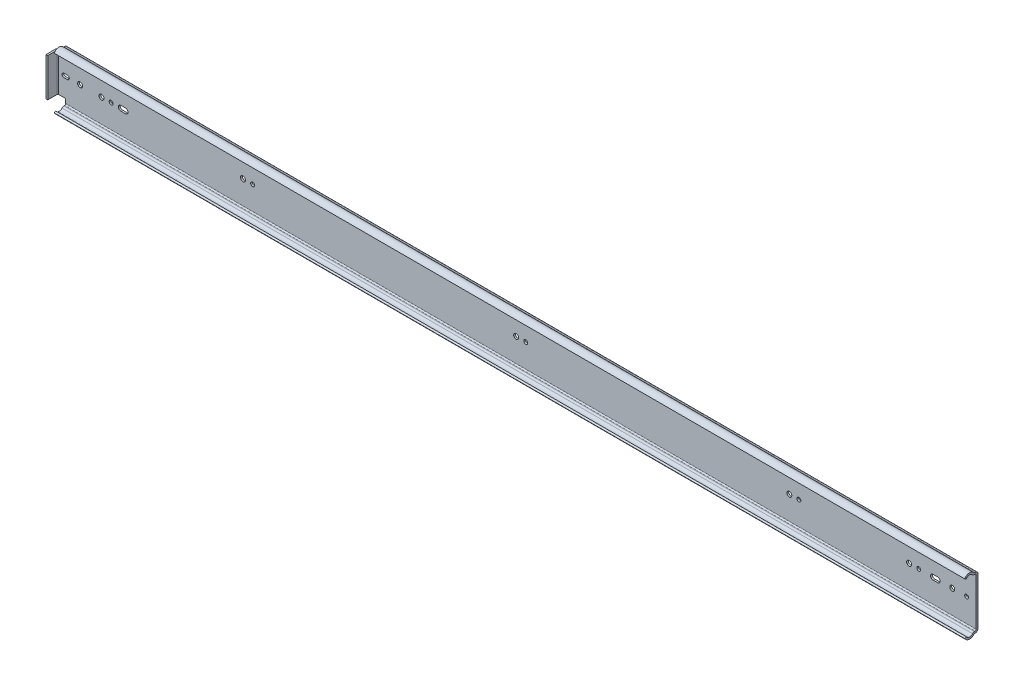
from build123d import *
from build123d.topology import SkipClean

# Parameters (mm, degrees)
EXTRUDE_THIN1_START     = -609.6
EXTRUDE_THIN1_DEPTH     = 1219.2
EXTRUDE_THIN2_DEPTH     = 1212.85
EXTRUDE_THIN5_START     = -1216.66
EXTRUDE_THIN5_DEPTH     = 1216.66
CUT_EXTRUDE1_DEPTH      = 1830.230661576
CUT_EXTRUDE1_DEPTH_BACK = 1830.230661576
SKETCH6_W               = 12.7
SKETCH6_H               = 12.7
SKETCH9_W               = 2.3622
SKETCH9_H               = 13.3858
EXTRUDE1_DEPTH          = 25.4
FILLET1_R               = 1.016
FILLET2_R               = 3.3782
CUT_EXTRUDE2_DEPTH      = 2.3622
SKETCH2_R               = 2.5781
SKETCH2_R_2             = 3.302
CUT_EXTRUDE12_DEPTH     = 2.3622
SKETCH22_R              = 2.5781
SKETCH22_R_2            = 3.302
SKETCH22_R_3            = 3.5687
CUT_EXTRUDE13_DEPTH     = 2.3622
SKETCH23_R              = 2.5781
SKETCH23_R_2            = 3.302
CUT_EXTRUDE14_DEPTH     = 2.3622
SKETCH24_R              = 2.5781
SKETCH24_R_2            = 3.302
CUT_EXTRUDE15_DEPTH     = 2.3622
SKETCH25_R              = 2.5781
SKETCH25_R_2            = 3.302
CUT_EXTRUDE16_DEPTH     = 2.3622
SKETCH27_R              = 3.5687
CUT_E_DEPTH             = 2.3622
SKETCH28_R              = 3.302
CUT_F_DEPTH             = 2.3622
SKETCH29_R              = 2.5781
CUT_EXTRUDE18_DEPTH     = 2.3622
CUT_H_DEPTH             = 2.3622
CUT_J_DEPTH             = 2.3622
SKETCH32_R              = 2.5781
SKETCH32_R_2            = 3.302
CUT_EXTRUDE21_DEPTH     = 2.3622
SKETCH210_R             = 2.5781
SKETCH210_R_2           = 3.302
CUT_EXTRUDE19_DEPTH     = 2.3622
SKETCH211_R             = 2.5781
SKETCH211_R_2           = 3.302
CUT_EXTRUDE110_DEPTH    = 2.3622
SKETCH212_R             = 2.5781
SKETCH212_R_2           = 3.302
CUT_EXTRUDE111_DEPTH    = 2.3622
SKETCH214_R             = 2.5781
SKETCH214_R_2           = 3.302
CUT_EXTRUDE113_DEPTH    = 2.3622
SKETCH215_R             = 3.302
CUT_EXTRUDE114_DEPTH    = 2.3622
CUT_R_DEPTH             = 2.3622
LPATTERN1_COUNT         = 23
LPATTERN1_PITCH         = 25.4
EXTRUDE2_DEPTH          = 12.7
EXTRUDE2_DEPTH_BACK     = 565.15
SKETCH218_W             = 11.43
SKETCH218_H             = 1.27
LPATTERN2_COUNT         = 23
LPATTERN2_PITCH         = 25.4
EXTRUDE3_DEPTH          = 12.7
EXTRUDE3_DEPTH_BACK     = 568.96
SKETCH220_W             = 9.245599771
SKETCH220_H             = 1.27


# Read off the part's stored shape, not the designer's step: Extrude-Thin1, Extrude-Thin5
with BuildPart() as part:
    # Extrude-Thin1 outline → Extrude-Thin1 (new body)
    with BuildSketch(Plane(origin=(0, 0, 0), x_dir=(0, 0, -1), z_dir=(1, 0, 0)).offset(EXTRUDE_THIN1_START)):
        with BuildLine():
            ThreePointArc((5.752462483, 35.334775085), (-0.647910774, 38.071449668), (-6.469678085, 34.255536805))
            Line((-6.469678085, 34.255536805), (-4.394919251, 33.126216382))
            ThreePointArc((-4.394919251, 33.126216382), (-0.440132491, 35.718405464), (3.907707273, 33.85935411))
            ThreePointArc((3.907707273, 33.85935411), (4.993998236, 32.994951487), (6.347544809, 32.686517335))
            Line((6.347544809, 32.686517335), (7.175193262, 32.686517335))
            ThreePointArc((7.175193262, 32.686517335), (8.297725277, 32.22154935), (8.762693262, 31.099017335))
            Line((8.762693262, 31.099017335), (8.762693262, 0))
            Line((8.762693262, 0), (11.124893262, 0))
            Line((11.124893262, 0), (11.124893262, 31.099017335))
            ThreePointArc((11.124893262, 31.099017335), (9.968052916, 33.891876989), (7.175193262, 35.048717335))
            Line((7.175193262, 35.048717335), (6.347544809, 35.048717335))
            ThreePointArc((6.347544809, 35.048717335), (6.017411498, 35.123945177), (5.752462483, 35.334775085))
        make_face()
    extrude(amount=EXTRUDE_THIN1_DEPTH)

    # Sketch6 → Cut-Extrude1 (cut, two sides: drawn at the far end of the back side and taken through both)
    with BuildSketch(Plane.XY.offset(-CUT_EXTRUDE1_DEPTH_BACK)):
        with Locations((-603.25, 31.75)):
            Rectangle(SKETCH6_W, SKETCH6_H)
    extrude(amount=CUT_EXTRUDE1_DEPTH + CUT_EXTRUDE1_DEPTH_BACK, mode=Mode.SUBTRACT)

    # Sketch9 → Extrude1 (add)
    with BuildSketch(Plane(origin=(0, 25.4, 0), x_dir=(-1, 0, 0), z_dir=(0, 1, 0))):
        with Locations((608.4189, -2.069793262)):
            Rectangle(SKETCH9_W, SKETCH9_H)
    extrude(amount=-EXTRUDE1_DEPTH)

    # Fillet1
    fillet1_edges = [part.edges().sort_by_distance(p)[0] for p in [
        (-607.2378, 12.7, -8.762693262),
    ]]
    fillet(fillet1_edges, radius=FILLET1_R)

    # Fillet2
    fillet2_edges = [part.edges().sort_by_distance(p)[0] for p in [
        (-609.6, 12.7, -11.124893262),
    ]]
    fillet(fillet2_edges, radius=FILLET2_R)

    # Sketch32 → Cut-Extrude21 (cut)
    with BuildSketch(Plane.XY.offset(-8.762693262)):
        with Locations((596.9, 0)):
            Circle(SKETCH32_R)
        with Locations((577.85, 0)):
            Circle(SKETCH32_R_2)
        with Locations((520.7, 0)):
            Circle(SKETCH32_R_2)
        with Locations((533.4, 0)):
            Circle(SKETCH32_R)
        with BuildLine():
            Line((549.148, 0), (561.848, 0))
            ThreePointArc((561.848, 0), (560.880866591, 2.334866591), (558.546, 3.302))
            Line((558.546, 3.302), (552.45, 3.302))
            ThreePointArc((552.45, 3.302), (550.115133409, 2.334866591), (549.148, 0))
        make_face()
    extrude(amount=-CUT_EXTRUDE21_DEPTH, mode=Mode.SUBTRACT)

    # Sketch210 → Cut-Extrude19 (cut)
    with BuildSketch(Plane(origin=(-677.249248887, 14.903736783, -8.762693262), x_dir=(1, 0, 0), z_dir=(0, 0, 1))):
        with Locations((1051.899248887, -14.903736783)):
            Circle(SKETCH210_R)
        with Locations((1039.199248887, -14.903736783)):
            Circle(SKETCH210_R_2)
    extrude(amount=-CUT_EXTRUDE19_DEPTH, mode=Mode.SUBTRACT)

    # Sketch211 → Cut-Extrude110 (cut)
    with BuildSketch(Plane(origin=(-447.985498291, 15.81613418, -8.762693262), x_dir=(1, 0, 0), z_dir=(0, 0, 1))):
        with Locations((460.685498291, -15.81613418)):
            Circle(SKETCH211_R)
        with Locations((447.985498291, -15.81613418)):
            Circle(SKETCH211_R_2)
    extrude(amount=-CUT_EXTRUDE110_DEPTH, mode=Mode.SUBTRACT)

    # Sketch212 → Cut-Extrude111 (cut)
    with BuildSketch(Plane(origin=(250.194594693, 14.477181682, -8.762693262), x_dir=(1, 0, 0), z_dir=(0, 0, 1))):
        with Locations((-599.444594693, -14.477181682)):
            Circle(SKETCH212_R)
        with Locations((-612.144594693, -14.477181682)):
            Circle(SKETCH212_R_2)
    extrude(amount=-CUT_EXTRUDE111_DEPTH, mode=Mode.SUBTRACT)

    # Sketch214 → Cut-Extrude113 (cut)
    with BuildSketch(Plane(origin=(529.798432462, 18.139402612, -8.762693262), x_dir=(1, 0, 0), z_dir=(0, 0, 1))):
        with Locations((-1066.500432462, -18.139402612)):
            Circle(SKETCH214_R)
        with Locations((-1079.200432462, -18.139402612)):
            Circle(SKETCH214_R_2)
        with BuildLine():
            Line((-1044.148432462, -18.139402612), (-1056.848432462, -18.139402612))
            ThreePointArc((-1056.848432462, -18.139402612), (-1055.881299054, -15.80453602), (-1053.546432462, -14.837402612))
            Line((-1053.546432462, -14.837402612), (-1047.450432462, -14.837402612))
            ThreePointArc((-1047.450432462, -14.837402612), (-1045.115565871, -15.80453602), (-1044.148432462, -18.139402612))
        make_face()
    extrude(amount=-CUT_EXTRUDE113_DEPTH, mode=Mode.SUBTRACT)

    # Sketch215 → Cut-Extrude114 (cut)
    with BuildSketch(Plane(origin=(674.3557152, 11.320285871, -8.762693262), x_dir=(1, 0, 0), z_dir=(0, 0, 1))):
        with Locations((-1252.2057152, -11.320285871)):
            Circle(SKETCH215_R)
    extrude(amount=-CUT_EXTRUDE114_DEPTH, mode=Mode.SUBTRACT)

    # Sketch216 → Cut R (cut)
    with BuildSketch(Plane.XY.offset(-8.762693262)):
        with BuildLine():
            Line((-601.6625, 0), (-592.1375, 0))
            ThreePointArc((-592.1375, 0), (-592.892608007, 1.822991993), (-594.7156, 2.5781))
            Line((-594.7156, 2.5781), (-599.0844, 2.5781))
            ThreePointArc((-599.0844, 2.5781), (-600.907391993, 1.822991993), (-601.6625, 0))
        make_face()
    extrude(amount=-CUT_R_DEPTH, mode=Mode.SUBTRACT)

    # Mirror1 3: part across plane


with BuildPart() as body_2:
    # Sketch4 → Extrude-Thin2 (new body)
    with BuildSketch(Plane(origin=(1219.2, 0, 0), x_dir=(0, 0, -1), z_dir=(1, 0, 0))):
        with BuildLine():
            ThreePointArc((3.54024831, 19.789205828), (0.77024158, 21.457292879), (-2.36668079, 20.672965307))
            ThreePointArc((-2.36668079, 20.672965307), (-3.091811244, 20.294053258), (-3.898522237, 20.157649845))
            ThreePointArc((-3.898522237, 20.157649845), (-5.766174756, 20.914093138), (-6.542172842, 22.773705828))
            Line((-6.542172842, 22.773705828), (-6.542172842, 25.161305828))
            ThreePointArc((-6.542172842, 25.161305828), (-5.766174756, 27.020918518), (-3.898522237, 27.77736181))
            ThreePointArc((-3.898522237, 27.77736181), (-3.659975019, 27.729624759), (-3.455361804, 27.598030559))
            ThreePointArc((-3.455361804, 27.598030559), (-0.023095262, 26.226172038), (3.414460302, 27.584723163))
            ThreePointArc((3.414460302, 27.584723163), (6.244879756, 28.080225918), (7.822893148, 25.678836527))
            Line((7.822893148, 25.678836527), (7.822893148, 11.408756936))
            ThreePointArc((7.822893148, 11.408756936), (7.431553352, 9.948256936), (6.362393148, 8.879096732))
            Line((6.362393148, 8.879096732), (3.123893148, 7.009347885))
            ThreePointArc((3.123893148, 7.009347885), (2.84498179, 6.730436527), (2.742893148, 6.349436527))
            Line((2.742893148, 6.349436527), (2.742893148, 0))
            Line((2.742893148, 0), (0.583893148, 0))
            Line((0.583893148, 0), (0.583893148, 6.349436527))
            ThreePointArc((0.583893148, 6.349436527), (0.975232943, 7.809936527), (2.044393148, 8.879096732))
            Line((2.044393148, 8.879096732), (5.282893148, 10.748845578))
            ThreePointArc((5.282893148, 10.748845578), (5.561804505, 11.027756936), (5.663893148, 11.408756936))
            Line((5.663893148, 11.408756936), (5.663893148, 25.678836527))
            ThreePointArc((5.663893148, 25.678836527), (5.388123817, 26.098496809), (4.893487408, 26.011904095))
            ThreePointArc((4.893487408, 26.011904095), (0.412345154, 24.079826794), (-4.266408016, 25.466487303))
            ThreePointArc((-4.266408016, 25.466487303), (-4.352985021, 25.324684037), (-4.383172842, 25.161305828))
            Line((-4.383172842, 25.161305828), (-4.383172842, 22.773705828))
            ThreePointArc((-4.383172842, 22.773705828), (-4.247561526, 22.448724969), (-3.921175649, 22.316530996))
            ThreePointArc((-3.921175649, 22.316530996), (-3.780197029, 22.340368486), (-3.653475202, 22.406586125))
            ThreePointArc((-3.653475202, 22.406586125), (1.089702598, 23.592527212), (5.278086268, 21.070299201))
            Line((5.278086268, 21.070299201), (3.54024831, 19.789205828))
        make_face()
    extrude(amount=-EXTRUDE_THIN2_DEPTH)

    # Mirror1: body 2 across plane


with BuildPart() as body_3:
    # Extrude-Thin5 outline → Extrude-Thin5 (new body)
    with BuildSketch(Plane(origin=(1828.8, 0, 0), x_dir=(0, 0, -1), z_dir=(1, 0, 0)).offset(EXTRUDE_THIN5_START)):
        with BuildLine():
            Line((-7.925106738, 0), (-5.562906738, 0))
            Line((-5.562906738, 0), (-5.562906738, 13.036209579))
            ThreePointArc((-5.562906738, 13.036209579), (-5.437890097, 13.255022954), (-5.185904431, 13.258440163))
            Line((-5.185904431, 13.258440163), (-2.932066495, 12.010964405))
            ThreePointArc((-2.932066495, 12.010964405), (1.369676528, 11.28348431), (5.180595526, 13.407423274))
            Line((5.180595526, 13.407423274), (3.41147618, 14.972736527))
            ThreePointArc((3.41147618, 14.972736527), (0.968956668, 13.611447462), (-1.788145038, 14.077708835))
            Line((-1.788145038, 14.077708835), (-4.041982973, 15.325184593))
            ThreePointArc((-4.041982973, 15.325184593), (-6.637435339, 15.28998734), (-7.925106738, 13.036209579))
            Line((-7.925106738, 13.036209579), (-7.925106738, 0))
        make_face()
    extrude(amount=EXTRUDE_THIN5_DEPTH)

    # Sketch10 → Cut-Extrude2 (cut)
    with BuildSketch(Plane.XY.offset(7.925106738)):
        with BuildLine():
            Line((1805.07005, 0), (1823.35805, 0))
            ThreePointArc((1823.35805, 0), (1814.21405, 9.144), (1805.07005, 0))
        make_face()
        with BuildLine():
            Line((1799.6281, 0), (1794.4719, 0))
            ThreePointArc((1794.4719, 0), (1797.05, 2.5781), (1799.6281, 0))
        make_face()
        with BuildLine():
            Line((1781.302, 0), (1774.698, 0))
            ThreePointArc((1774.698, 0), (1778, 3.302), (1781.302, 0))
        make_face()
        with BuildLine():
            Line((1762.252, 3.048), (1762.252, 0))
            Line((1762.252, 0), (1755.648, 0))
            Line((1755.648, 0), (1755.648, 3.048))
            ThreePointArc((1755.648, 3.048), (1758.95, 6.35), (1762.252, 3.048))
        make_face()
        with BuildLine():
            Line((1748.8281, 0), (1743.6719, 0))
            ThreePointArc((1743.6719, 0), (1746.25, 2.5781), (1748.8281, 0))
        make_face()
        with BuildLine():
            Line((1736.852, 0), (1730.248, 0))
            ThreePointArc((1730.248, 0), (1733.55, 3.302), (1736.852, 0))
        make_face()
    extrude(amount=-CUT_EXTRUDE2_DEPTH, mode=Mode.SUBTRACT)

    # Sketch2 → Cut-Extrude12 (cut)
    with BuildSketch(Plane(origin=(-2141.845428582, 6.157941778, 7.925106738), x_dir=(1, 0, 0), z_dir=(0, 0, 1))):
        with Locations((3824.595428582, -6.157941778)):
            Circle(SKETCH2_R)
        with Locations((3811.895428582, -6.157941778)):
            Circle(SKETCH2_R_2)
    extrude(amount=-CUT_EXTRUDE12_DEPTH, mode=Mode.SUBTRACT)

    # Sketch22 → Cut-Extrude13 (cut)
    with BuildSketch(Plane(origin=(-2143.135428603, 5.657950018, 7.925106738), x_dir=(1, 0, 0), z_dir=(0, 0, 1))):
        with Locations((3762.385428603, -5.657950018)):
            Circle(SKETCH22_R)
        with Locations((3730.635428603, -5.657950018)):
            Circle(SKETCH22_R_2)
        with Locations((3749.685428603, -5.657950018)):
            Circle(SKETCH22_R_3)
    extrude(amount=-CUT_EXTRUDE13_DEPTH, mode=Mode.SUBTRACT)

    # Sketch23 → Cut-Extrude14 (cut)
    with BuildSketch(Plane(origin=(-2022.429166167, 5.760053708, 7.925106738), x_dir=(1, 0, 0), z_dir=(0, 0, 1))):
        with Locations((3463.879166167, -5.760053708)):
            Circle(SKETCH23_R)
        with Locations((3451.179166167, -5.760053708)):
            Circle(SKETCH23_R_2)
    extrude(amount=-CUT_EXTRUDE14_DEPTH, mode=Mode.SUBTRACT)

    # Sketch24 → Cut-Extrude15 (cut)
    with BuildSketch(Plane(origin=(-1862.330020924, 7.905664942, 7.925106738), x_dir=(1, 0, 0), z_dir=(0, 0, 1))):
        with Locations((3151.380020924, -7.905664942)):
            Circle(SKETCH24_R)
        with Locations((3138.680020924, -7.905664942)):
            Circle(SKETCH24_R_2)
    extrude(amount=-CUT_EXTRUDE15_DEPTH, mode=Mode.SUBTRACT)

    # Sketch25 → Cut-Extrude16 (cut)
    with BuildSketch(Plane(origin=(-1718.369763818, 7.737387679, 7.925106738), x_dir=(1, 0, 0), z_dir=(0, 0, 1))):
        with Locations((2702.619763818, -7.737387679)):
            Circle(SKETCH25_R)
        with Locations((2689.919763818, -7.737387679)):
            Circle(SKETCH25_R_2)
    extrude(amount=-CUT_EXTRUDE16_DEPTH, mode=Mode.SUBTRACT)

    # Sketch27 → Cut E (cut)
    with BuildSketch(Plane.XY.offset(7.925106738)):
        with Locations((806.45, 0)):
            Circle(SKETCH27_R)
        with BuildLine():
            Line((796.8615, 0), (780.9865, 0))
            ThreePointArc((780.9865, 0), (781.953633409, 2.334866591), (784.2885, 3.302))
            Line((784.2885, 3.302), (793.5595, 3.302))
            ThreePointArc((793.5595, 3.302), (795.894366591, 2.334866591), (796.8615, 0))
        make_face()
    extrude(amount=-CUT_E_DEPTH, mode=Mode.SUBTRACT)

    # Sketch28 → Cut F (cut)
    with BuildSketch(Plane.XY.offset(7.925106738)):
        with Locations((728.726, 0)):
            Circle(SKETCH28_R)
    extrude(amount=-CUT_F_DEPTH, mode=Mode.SUBTRACT)

    # Sketch29 → Cut-Extrude18 (cut)
    with BuildSketch(Plane(origin=(-866.129297637, 5.417355799, 7.925106738), x_dir=(1, 0, 0), z_dir=(0, 0, 1))):
        with Locations((1582.155297637, -5.417355799)):
            Circle(SKETCH29_R)
        with BuildLine():
            Line((1574.217797637, -5.417355799), (1564.692797637, -5.417355799))
            ThreePointArc((1564.692797637, -5.417355799), (1565.659931046, -3.082489207), (1567.994797637, -2.115355799))
            Line((1567.994797637, -2.115355799), (1570.915797637, -2.115355799))
            ThreePointArc((1570.915797637, -2.115355799), (1573.250664228, -3.082489207), (1574.217797637, -5.417355799))
        make_face()
    extrude(amount=-CUT_EXTRUDE18_DEPTH, mode=Mode.SUBTRACT)

    # Sketch30 → Cut H (cut)
    with BuildSketch(Plane.XY.offset(7.925106738)):
        with BuildLine():
            Line((680.974, 0), (680.974, 3.048))
            ThreePointArc((680.974, 3.048), (684.276, 6.35), (687.578, 3.048))
            Line((687.578, 3.048), (687.578, 0))
            Line((687.578, 0), (680.974, 0))
        make_face()
    extrude(amount=-CUT_H_DEPTH, mode=Mode.SUBTRACT)

    # Sketch31 → Cut J (cut)
    with BuildSketch(Plane.XY.offset(7.925106738)):
        with BuildLine():
            Line((669.9885, 0), (660.4635, 0))
            ThreePointArc((660.4635, 0), (661.218608007, 1.822991993), (663.0416, 2.5781))
            Line((663.0416, 2.5781), (667.4104, 2.5781))
            ThreePointArc((667.4104, 2.5781), (669.233391993, 1.822991993), (669.9885, 0))
        make_face()
    extrude(amount=-CUT_J_DEPTH, mode=Mode.SUBTRACT)

    # Mirror1 2: body 3 across plane


with BuildPart() as body_2_1:
    add(body_2.part)
    add(body_2.part.mirror(Plane.ZX))


with BuildPart() as body_3_1:
    with SkipClean():  # the faces are left unmerged after this step: merging them gives an invalid solid
        add(body_3.part)
        add(body_3.part.mirror(Plane.ZX))


with BuildPart() as part_1:
    with SkipClean():  # the faces are left unmerged after this step: merging them gives an invalid solid
        add(part.part)
        add(part.part.mirror(Plane.ZX))


with BuildPart() as body_4:
    # Sketch217 → Revolve1 (revolve)
    with BuildSketch(Plane(origin=(584.2, 0, 0), x_dir=(0, 0, -1), z_dir=(1, 0, 0))):
        with BuildLine():
            Line((0, 35.7378), (0, 26.22652483))
            ThreePointArc((0, 26.22652483), (4.755637585, 30.982162415), (0, 35.7378))
        make_face()
    revolve(axis=Axis((584.2, 36.603094088, 0), (0, -1, 0)))


with BuildPart() as lpattern1_1:
    # LPattern1: pattern copy
    add(body_4.part.moved(Location(Vector(-1, 0, 0) * (1 * LPATTERN1_PITCH))))


with BuildPart() as lpattern1_2:
    # LPattern1: pattern copy
    add(body_4.part.moved(Location(Vector(-1, 0, 0) * (2 * LPATTERN1_PITCH))))


with BuildPart() as lpattern1_3:
    # LPattern1: pattern copy
    add(body_4.part.moved(Location(Vector(-1, 0, 0) * (3 * LPATTERN1_PITCH))))


with BuildPart() as lpattern1_4:
    # LPattern1: pattern copy
    add(body_4.part.moved(Location(Vector(-1, 0, 0) * (4 * LPATTERN1_PITCH))))


with BuildPart() as lpattern1_5:
    # LPattern1: pattern copy
    add(body_4.part.moved(Location(Vector(-1, 0, 0) * (5 * LPATTERN1_PITCH))))


with BuildPart() as lpattern1_6:
    # LPattern1: pattern copy
    add(body_4.part.moved(Location(Vector(-1, 0, 0) * (6 * LPATTERN1_PITCH))))


with BuildPart() as lpattern1_7:
    # LPattern1: pattern copy
    add(body_4.part.moved(Location(Vector(-1, 0, 0) * (7 * LPATTERN1_PITCH))))


with BuildPart() as lpattern1_8:
    # LPattern1: pattern copy
    add(body_4.part.moved(Location(Vector(-1, 0, 0) * (8 * LPATTERN1_PITCH))))


with BuildPart() as lpattern1_9:
    # LPattern1: pattern copy
    add(body_4.part.moved(Location(Vector(-1, 0, 0) * (9 * LPATTERN1_PITCH))))


with BuildPart() as lpattern1_10:
    # LPattern1: pattern copy
    add(body_4.part.moved(Location(Vector(-1, 0, 0) * (10 * LPATTERN1_PITCH))))


with BuildPart() as lpattern1_11:
    # LPattern1: pattern copy
    add(body_4.part.moved(Location(Vector(-1, 0, 0) * (11 * LPATTERN1_PITCH))))


with BuildPart() as lpattern1_12:
    # LPattern1: pattern copy
    add(body_4.part.moved(Location(Vector(-1, 0, 0) * (12 * LPATTERN1_PITCH))))


with BuildPart() as lpattern1_13:
    # LPattern1: pattern copy
    add(body_4.part.moved(Location(Vector(-1, 0, 0) * (13 * LPATTERN1_PITCH))))


with BuildPart() as lpattern1_14:
    # LPattern1: pattern copy
    add(body_4.part.moved(Location(Vector(-1, 0, 0) * (14 * LPATTERN1_PITCH))))


with BuildPart() as lpattern1_15:
    # LPattern1: pattern copy
    add(body_4.part.moved(Location(Vector(-1, 0, 0) * (15 * LPATTERN1_PITCH))))


with BuildPart() as lpattern1_16:
    # LPattern1: pattern copy
    add(body_4.part.moved(Location(Vector(-1, 0, 0) * (16 * LPATTERN1_PITCH))))


with BuildPart() as lpattern1_17:
    # LPattern1: pattern copy
    add(body_4.part.moved(Location(Vector(-1, 0, 0) * (17 * LPATTERN1_PITCH))))


with BuildPart() as lpattern1_18:
    # LPattern1: pattern copy
    add(body_4.part.moved(Location(Vector(-1, 0, 0) * (18 * LPATTERN1_PITCH))))


with BuildPart() as lpattern1_19:
    # LPattern1: pattern copy
    add(body_4.part.moved(Location(Vector(-1, 0, 0) * (19 * LPATTERN1_PITCH))))


with BuildPart() as lpattern1_20:
    # LPattern1: pattern copy
    add(body_4.part.moved(Location(Vector(-1, 0, 0) * (20 * LPATTERN1_PITCH))))


with BuildPart() as lpattern1_21:
    # LPattern1: pattern copy
    add(body_4.part.moved(Location(Vector(-1, 0, 0) * (21 * LPATTERN1_PITCH))))


with BuildPart() as lpattern1_22:
    # LPattern1: pattern copy
    add(body_4.part.moved(Location(Vector(-1, 0, 0) * (22 * LPATTERN1_PITCH))))


with BuildPart() as body_4_1:
    add(body_4.part)

    add(lpattern1_1.part)  # Extrude2 merges LPattern1_1

    add(lpattern1_2.part)  # Extrude2 merges LPattern1_2

    add(lpattern1_3.part)  # Extrude2 merges LPattern1_3

    add(lpattern1_4.part)  # Extrude2 merges LPattern1_4

    add(lpattern1_5.part)  # Extrude2 merges LPattern1_5

    add(lpattern1_6.part)  # Extrude2 merges LPattern1_6

    add(lpattern1_7.part)  # Extrude2 merges LPattern1_7

    add(lpattern1_8.part)  # Extrude2 merges LPattern1_8

    add(lpattern1_9.part)  # Extrude2 merges LPattern1_9

    add(lpattern1_10.part)  # Extrude2 merges LPattern1_10

    add(lpattern1_11.part)  # Extrude2 merges LPattern1_11

    add(lpattern1_12.part)  # Extrude2 merges LPattern1_12

    add(lpattern1_13.part)  # Extrude2 merges LPattern1_13

    add(lpattern1_14.part)  # Extrude2 merges LPattern1_14

    add(lpattern1_15.part)  # Extrude2 merges LPattern1_15

    add(lpattern1_16.part)  # Extrude2 merges LPattern1_16

    add(lpattern1_17.part)  # Extrude2 merges LPattern1_17

    add(lpattern1_18.part)  # Extrude2 merges LPattern1_18

    add(lpattern1_19.part)  # Extrude2 merges LPattern1_19

    add(lpattern1_20.part)  # Extrude2 merges LPattern1_20

    add(lpattern1_21.part)  # Extrude2 merges LPattern1_21

    add(lpattern1_22.part)  # Extrude2 merges LPattern1_22
    # Sketch218 → Extrude2 (add, two sides: drawn at the far end of the back side and taken through both)
    with BuildSketch(Plane(origin=(584.2, 0, 0), x_dir=(0, 0, -1), z_dir=(1, 0, 0)).offset(-EXTRUDE2_DEPTH_BACK)):
        with Locations((0, 30.9753)):
            Rectangle(SKETCH218_W, SKETCH218_H)
    extrude(amount=EXTRUDE2_DEPTH + EXTRUDE2_DEPTH_BACK)


with BuildPart() as body_5:
    # Sketch219 → Revolve2 (revolve)
    with BuildSketch(Plane(origin=(1193.8, 0, 0), x_dir=(0, 0, -1), z_dir=(1, 0, 0))):
        with BuildLine():
            Line((-0.000306852, 21.487836527), (-0.000306852, 13.550336527))
            ThreePointArc((-0.000306852, 13.550336527), (3.968443148, 17.519086527), (-0.000306852, 21.487836527))
        make_face()
    revolve(axis=Axis((1193.8, 22.284965157, 0.000306852), (0, -1, 0)))


with BuildPart() as lpattern2_1:
    # LPattern2: pattern copy
    add(body_5.part.moved(Location(Vector(-1, 0, 0) * (1 * LPATTERN2_PITCH))))


with BuildPart() as lpattern2_2:
    # LPattern2: pattern copy
    add(body_5.part.moved(Location(Vector(-1, 0, 0) * (2 * LPATTERN2_PITCH))))


with BuildPart() as lpattern2_3:
    # LPattern2: pattern copy
    add(body_5.part.moved(Location(Vector(-1, 0, 0) * (3 * LPATTERN2_PITCH))))


with BuildPart() as lpattern2_4:
    # LPattern2: pattern copy
    add(body_5.part.moved(Location(Vector(-1, 0, 0) * (4 * LPATTERN2_PITCH))))


with BuildPart() as lpattern2_5:
    # LPattern2: pattern copy
    add(body_5.part.moved(Location(Vector(-1, 0, 0) * (5 * LPATTERN2_PITCH))))


with BuildPart() as lpattern2_6:
    # LPattern2: pattern copy
    add(body_5.part.moved(Location(Vector(-1, 0, 0) * (6 * LPATTERN2_PITCH))))


with BuildPart() as lpattern2_7:
    # LPattern2: pattern copy
    add(body_5.part.moved(Location(Vector(-1, 0, 0) * (7 * LPATTERN2_PITCH))))


with BuildPart() as lpattern2_8:
    # LPattern2: pattern copy
    add(body_5.part.moved(Location(Vector(-1, 0, 0) * (8 * LPATTERN2_PITCH))))


with BuildPart() as lpattern2_9:
    # LPattern2: pattern copy
    add(body_5.part.moved(Location(Vector(-1, 0, 0) * (9 * LPATTERN2_PITCH))))


with BuildPart() as lpattern2_10:
    # LPattern2: pattern copy
    add(body_5.part.moved(Location(Vector(-1, 0, 0) * (10 * LPATTERN2_PITCH))))


with BuildPart() as lpattern2_11:
    # LPattern2: pattern copy
    add(body_5.part.moved(Location(Vector(-1, 0, 0) * (11 * LPATTERN2_PITCH))))


with BuildPart() as lpattern2_12:
    # LPattern2: pattern copy
    add(body_5.part.moved(Location(Vector(-1, 0, 0) * (12 * LPATTERN2_PITCH))))


with BuildPart() as lpattern2_13:
    # LPattern2: pattern copy
    add(body_5.part.moved(Location(Vector(-1, 0, 0) * (13 * LPATTERN2_PITCH))))


with BuildPart() as lpattern2_14:
    # LPattern2: pattern copy
    add(body_5.part.moved(Location(Vector(-1, 0, 0) * (14 * LPATTERN2_PITCH))))


with BuildPart() as lpattern2_15:
    # LPattern2: pattern copy
    add(body_5.part.moved(Location(Vector(-1, 0, 0) * (15 * LPATTERN2_PITCH))))


with BuildPart() as lpattern2_16:
    # LPattern2: pattern copy
    add(body_5.part.moved(Location(Vector(-1, 0, 0) * (16 * LPATTERN2_PITCH))))


with BuildPart() as lpattern2_17:
    # LPattern2: pattern copy
    add(body_5.part.moved(Location(Vector(-1, 0, 0) * (17 * LPATTERN2_PITCH))))


with BuildPart() as lpattern2_18:
    # LPattern2: pattern copy
    add(body_5.part.moved(Location(Vector(-1, 0, 0) * (18 * LPATTERN2_PITCH))))


with BuildPart() as lpattern2_19:
    # LPattern2: pattern copy
    add(body_5.part.moved(Location(Vector(-1, 0, 0) * (19 * LPATTERN2_PITCH))))


with BuildPart() as lpattern2_20:
    # LPattern2: pattern copy
    add(body_5.part.moved(Location(Vector(-1, 0, 0) * (20 * LPATTERN2_PITCH))))


with BuildPart() as lpattern2_21:
    # LPattern2: pattern copy
    add(body_5.part.moved(Location(Vector(-1, 0, 0) * (21 * LPATTERN2_PITCH))))


with BuildPart() as lpattern2_22:
    # LPattern2: pattern copy
    add(body_5.part.moved(Location(Vector(-1, 0, 0) * (22 * LPATTERN2_PITCH))))


with BuildPart() as body_5_1:
    add(body_5.part)

    add(lpattern2_1.part)  # Extrude3 merges LPattern2_1

    add(lpattern2_2.part)  # Extrude3 merges LPattern2_2

    add(lpattern2_3.part)  # Extrude3 merges LPattern2_3

    add(lpattern2_4.part)  # Extrude3 merges LPattern2_4

    add(lpattern2_5.part)  # Extrude3 merges LPattern2_5

    add(lpattern2_6.part)  # Extrude3 merges LPattern2_6

    add(lpattern2_7.part)  # Extrude3 merges LPattern2_7

    add(lpattern2_8.part)  # Extrude3 merges LPattern2_8

    add(lpattern2_9.part)  # Extrude3 merges LPattern2_9

    add(lpattern2_10.part)  # Extrude3 merges LPattern2_10

    add(lpattern2_11.part)  # Extrude3 merges LPattern2_11

    add(lpattern2_12.part)  # Extrude3 merges LPattern2_12

    add(lpattern2_13.part)  # Extrude3 merges LPattern2_13

    add(lpattern2_14.part)  # Extrude3 merges LPattern2_14

    add(lpattern2_15.part)  # Extrude3 merges LPattern2_15

    add(lpattern2_16.part)  # Extrude3 merges LPattern2_16

    add(lpattern2_17.part)  # Extrude3 merges LPattern2_17

    add(lpattern2_18.part)  # Extrude3 merges LPattern2_18

    add(lpattern2_19.part)  # Extrude3 merges LPattern2_19

    add(lpattern2_20.part)  # Extrude3 merges LPattern2_20

    add(lpattern2_21.part)  # Extrude3 merges LPattern2_21

    add(lpattern2_22.part)  # Extrude3 merges LPattern2_22
    # Sketch220 → Extrude3 (add, two sides: drawn at the far end of the back side and taken through both)
    with BuildSketch(Plane(origin=(1193.8, 0, 0), x_dir=(0, 0, -1), z_dir=(1, 0, 0)).offset(-EXTRUDE3_DEPTH_BACK)):
        with Locations((-0.000306853, 17.519086527)):
            Rectangle(SKETCH220_W, SKETCH220_H)
    extrude(amount=EXTRUDE3_DEPTH + EXTRUDE3_DEPTH_BACK)


with BuildPart() as body_6:
    # Mirror3: mirrored copy
    add(body_4_1.part.mirror(Plane.ZX))


with BuildPart() as body_7:
    # Mirror3 2: mirrored copy
    add(body_5_1.part.mirror(Plane.ZX))


solid = part_1.part
